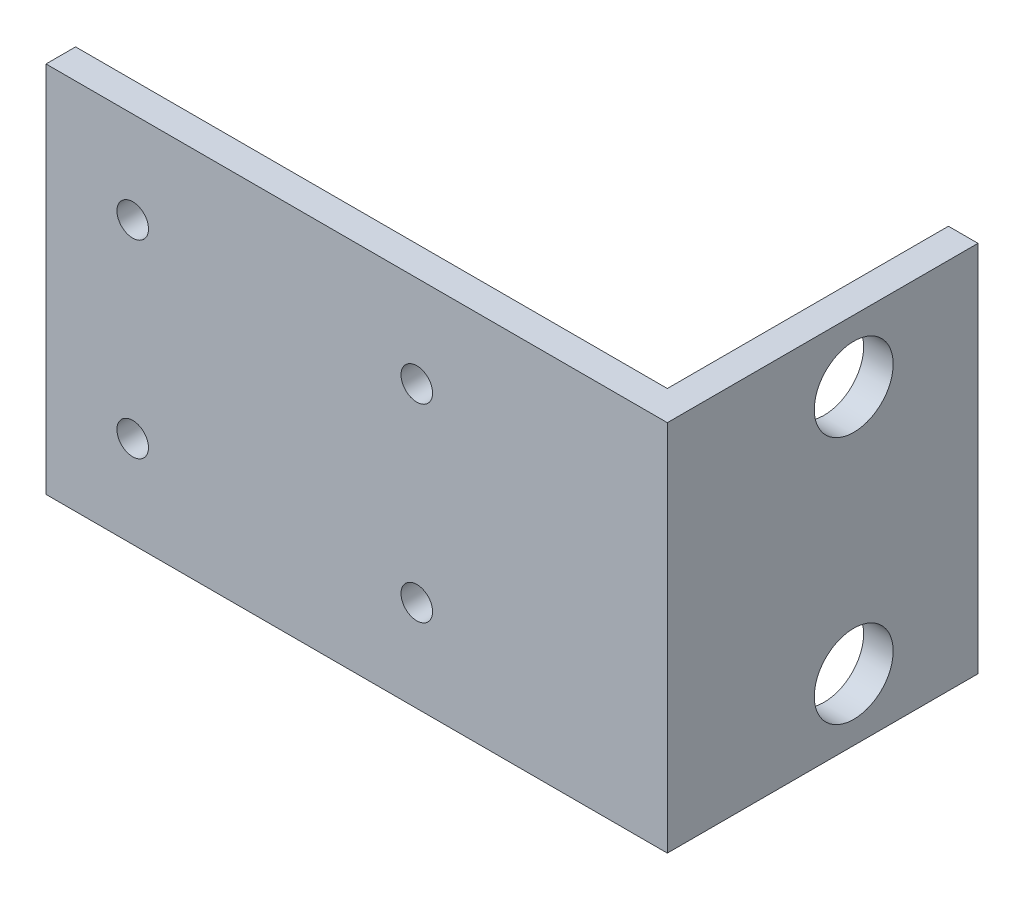
from build123d import *

# Parameters (mm, degrees)
BOSS_EXTRUDE1_DEPTH = 30
SKETCH2_R           = 1.27
CUT_EXTRUDE1_DEPTH  = 62.583645163
SKETCH3_R           = 3.175
CUT_EXTRUDE2_DEPTH  = 63.542848125


with BuildPart() as part:
    # Sketch1 → Boss-Extrude1 (new body)
    with BuildSketch(Plane(origin=(0, 0, 0), x_dir=(1, 0, 0), z_dir=(0, 1, 0))):
        Polygon((0, 0), (0, 22.61875), (2.38125, 22.61875), (2.38125, -2.38125), (-47.61875, -2.38125), (-47.61875, 0), align=None)
    extrude(amount=BOSS_EXTRUDE1_DEPTH)

    # Sketch2 → Cut-Extrude1 (cut, through all)
    with BuildSketch(Plane.XY.offset(2.38125)):
        with Locations((-40.64, 7.38)):
            Circle(SKETCH2_R)
        with Locations((-17.78, 7.38)):
            Circle(SKETCH2_R)
        with Locations((-17.78, 22.62)):
            Circle(SKETCH2_R)
        with Locations((-40.64, 22.62)):
            Circle(SKETCH2_R)
    extrude(amount=-CUT_EXTRUDE1_DEPTH, mode=Mode.SUBTRACT)

    # Sketch3 → Cut-Extrude2 (cut, through all)
    with BuildSketch(Plane(origin=(2.38125, 0, 0), x_dir=(0, 0, -1), z_dir=(1, 0, 0))):
        with Locations((12.61875, 25)):
            Circle(SKETCH3_R)
        with Locations((12.61875, 5)):
            Circle(SKETCH3_R)
    extrude(amount=-CUT_EXTRUDE2_DEPTH, mode=Mode.SUBTRACT)


solid = part.part
